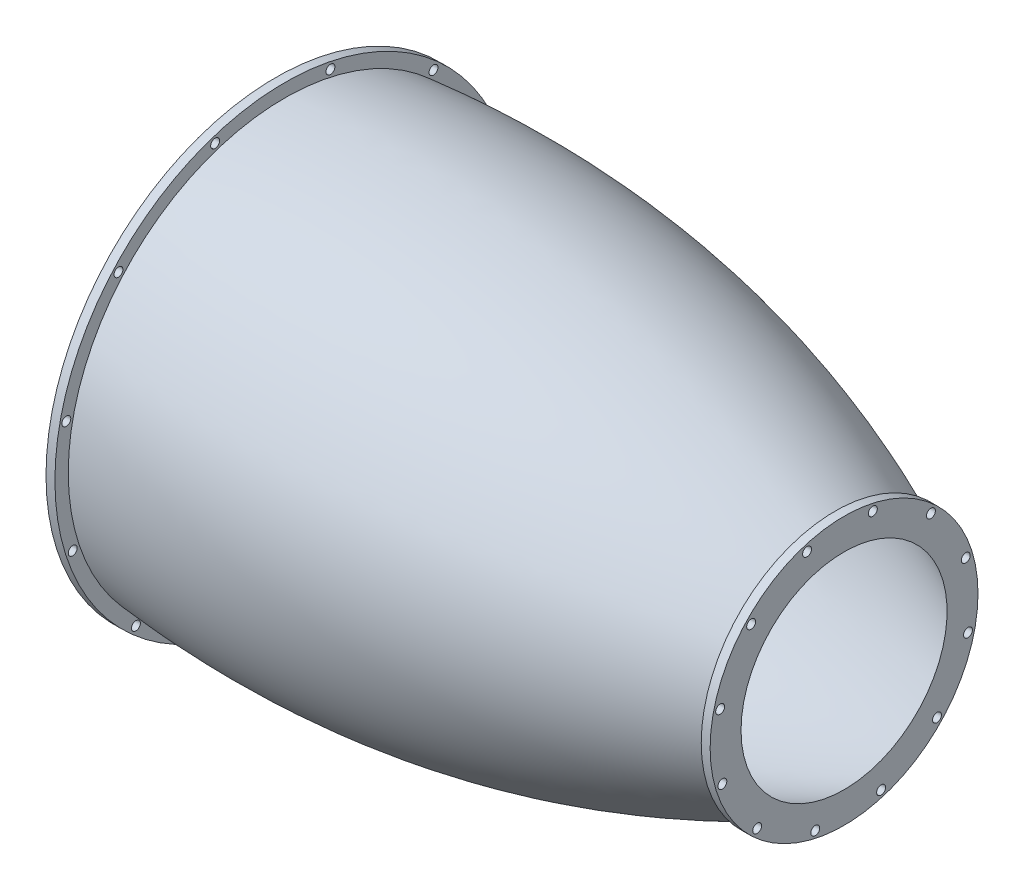
from build123d import *

# Parameters (mm, degrees)
SKETCH4_W           = 2299.140163329
SKETCH4_H           = 1084.867048291
CUT_EXTRUDE1_DEPTH  = 782.066
SKETCH5_R           = 95.504801646
SKETCH5_R_2         = 82.804801646
BOSS_EXTRUDE1_DEPTH = 6.35
SKETCH6_R           = 163.859870936
SKETCH6_R_2         = 153.699870936
BOSS_EXTRUDE2_DEPTH = 6.35
CIRPATTERN1_COUNT   = 12
CIRPATTERN2_COUNT   = 12


with BuildPart() as part:
    # Sketch1 → Revolve3 (revolve)
    with BuildSketch(Plane.XY):
        with BuildLine():
            Line((500, 330.2), (500, 339.09))
            add(Edge.make_bspline(
                [(0, 78.994), (170.262088596, 327.756991404), (500, 339.09)],
                knots=[0, 0, 0, 1, 1, 1], degree=2))
            add(Edge.make_bspline(
                [(0, 78.994), (-192.730394607, 176.706088879), (-412.824178468, 153.699870936)],
                knots=[0, 0, 0, 1, 1, 1], degree=2))
            Line((-412.824178468, 153.699870936), (-412.824178468, 144.809870936))
            add(Edge.make_bspline(
                [(0, 70.104), (-195.449728047, 157.410787998), (-412.824178468, 144.809870936)],
                knots=[0, 0, 0, 1, 1, 1], degree=2))
            add(Edge.make_bspline(
                [(0, 70.104), (170.262088596, 318.866991404), (500, 330.2)],
                knots=[0, 0, 0, 1, 1, 1], degree=2))
        make_face()
    revolve(axis=Axis((-1229.828239288, 0, 0), (1, 0, 0)))

    # Sketch4 → Cut-Extrude1 (cut)
    with BuildSketch(Plane.ZY.offset(7.62)):
        with Locations((-63.658537287, 96.480710784)):
            Rectangle(SKETCH4_W, SKETCH4_H)
    extrude(amount=-CUT_EXTRUDE1_DEPTH, mode=Mode.SUBTRACT)

    # Sketch5 → Boss-Extrude1 (add)
    with BuildSketch(Plane(origin=(-7.62, 0, 0), x_dir=(0, 0, -1), z_dir=(1, 0, 0))):
        Circle(SKETCH5_R)
        Circle(SKETCH5_R_2, mode=Mode.SUBTRACT)
    extrude(amount=-BOSS_EXTRUDE1_DEPTH)

    # Sketch6 → Boss-Extrude2 (add)
    with BuildSketch(Plane.ZY.offset(412.824178468)):
        Circle(SKETCH6_R)
        Circle(SKETCH6_R_2, mode=Mode.SUBTRACT)
    extrude(amount=-BOSS_EXTRUDE2_DEPTH)

    # Sketch8 → 1/4 (0.25) Diameter Hole1 (revolve, cut)
    with BuildSketch(Plane(origin=(-13.97, -88.351509107, 20.518383176), x_dir=(0, 0, 1), z_dir=(0, 1, 0))):
        Polygon((0, 0), (0, 8.257732465), (3.175, 6.35), (3.175, 0), align=None)
    f_1_4_0_25_diameter_hole1 = revolve(axis=Axis((-20.32, -88.351509107, 20.518383176), (1, 0, 0)), mode=Mode.SUBTRACT)

    # CirPattern1: 1/4 (0.25) Diameter Hole1 ×12 about axis
    cirpattern1_axis = Axis((-13.97, 0, 0), (1, 0, 0))
    for i in range(1, CIRPATTERN1_COUNT):
        add(f_1_4_0_25_diameter_hole1.rotate(cirpattern1_axis, i * 360 / CIRPATTERN1_COUNT), mode=Mode.SUBTRACT)

    # Sketch10 → 1/4 (0.25) Diameter Hole2 (revolve, cut)
    with BuildSketch(Plane(origin=(-406.474178468, -155.721669204, 32.609841658), x_dir=(0, 0, -1), z_dir=(0, 1, 0))):
        Polygon((0, 0), (0, 8.257732465), (3.175, 6.35), (3.175, 0), align=None)
    f_1_4_0_25_diameter_hole2 = revolve(axis=Axis((-400.124178468, -155.721669204, 32.609841658), (-1, 0, 0)), mode=Mode.SUBTRACT)

    # CirPattern2: 1/4 (0.25) Diameter Hole2 ×12 about axis
    cirpattern2_axis = Axis((-406.474178468, 0, 0), (-1, 0, 0))
    for i in range(1, CIRPATTERN2_COUNT):
        add(f_1_4_0_25_diameter_hole2.rotate(cirpattern2_axis, i * 360 / CIRPATTERN2_COUNT), mode=Mode.SUBTRACT)


solid = part.part
